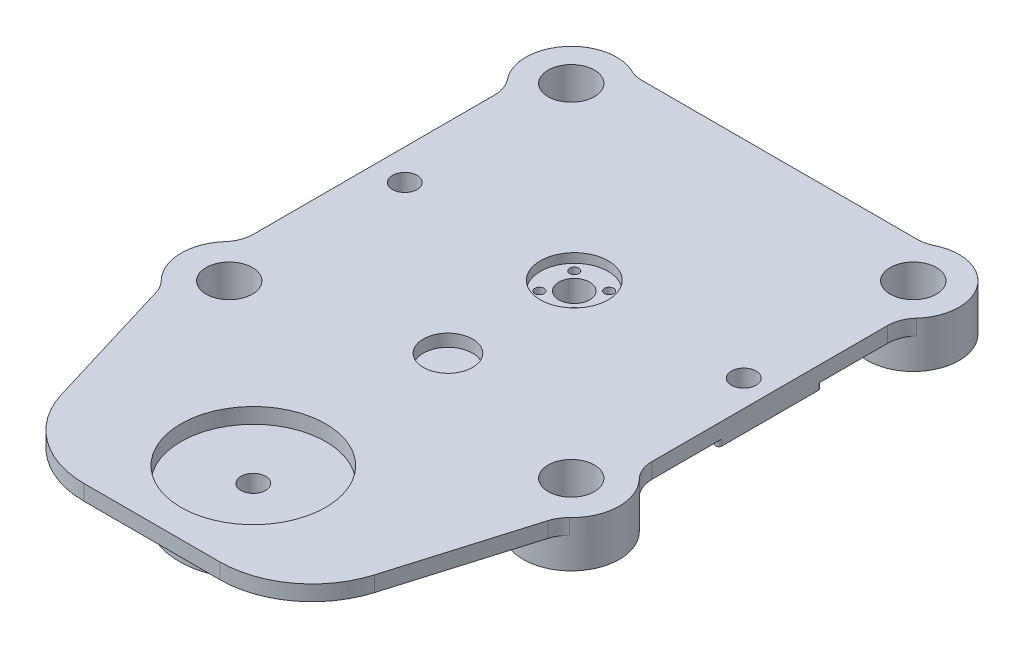
from build123d import *
from build123d.topology import SkipClean

# Parameters (mm, degrees)
SKETCH1_R           = 7.5
BOSS_EXTRUDE1_DEPTH = 15
SKETCH4_R           = 5
CUT_EXTRUDE2_DEPTH  = 20
SKETCH5_R           = 11
CUT_EXTRUDE3_DEPTH  = 3
SKETCH6_R           = 1.5
CUT_EXTRUDE4_DEPTH  = 133.338393859
SKETCH7_R           = 8
CUT_EXTRUDE5_DEPTH  = 4
FILLET3_R           = 30
FILLET4_R           = 10
SKETCH9_R           = 23.5
CUT_EXTRUDE6_DEPTH  = 5
SKETCH10_R          = 4
CUT_EXTRUDE7_DEPTH  = 133.172048819
SKETCH11_R          = 12
CUT_EXTRUDE8_DEPTH  = 8
FILLET5_R           = 10
SKETCH12_R          = 4
CUT_EXTRUDE9_DEPTH  = 133.035792455
SKETCH14_R          = 24
SKETCH14_R_2        = 15
CUT_EXTRUDE16_DEPTH = 10
FILLET6_R           = 10
FILLET7_START       = 8
FILLET7_DEPTH       = 2


with BuildPart() as part:
    # Sketch1 → Boss-Extrude1 (new body)
    with BuildSketch(Plane(origin=(0, 0, 0), x_dir=(1, 0, 0), z_dir=(0, 1, 0))):
        with BuildLine():
            Line((-47.707272336, 93.074011467), (46.85801727, 93.074011467))
            ThreePointArc((46.85801727, 93.074011467), (67.451414768, 89.11955675), (63.55694563, 68.514731035))
            Line((63.55694563, 68.514731035), (63.55694563, -17.060551097))
            ThreePointArc((63.55694563, -17.060551097), (70.78018401, -29.882416282), (64.134785378, -43.013070362))
            Line((64.134785378, -43.013070362), (43.994737315, -110.750576059))
            Line((43.994737315, -110.750576059), (-44.651292342, -110.750576059))
            Line((-44.651292342, -110.750576059), (-65.275039181, -42.659888117))
            ThreePointArc((-65.275039181, -42.659888117), (-71.439667546, -30.058632987), (-65, -17.595689691))
            Line((-65, -17.595689691), (-65, 69.228067604))
            ThreePointArc((-65, 69.228067604), (-67.7628182, 89.424810491), (-47.707272336, 93.074011467))
        make_face()
        with Locations(Location((-55.828277514, 80.770057168, 0), (0, 0, 270))):
            Circle(SKETCH1_R, mode=Mode.SUBTRACT)
        with Locations(Location((55.171722486, 80.770057168, 0), (0, 0, 270))):
            Circle(SKETCH1_R, mode=Mode.SUBTRACT)
        with Locations(Location((-55.828277514, -30.229942832, 0), (0, 0, 270))):
            Circle(SKETCH1_R, mode=Mode.SUBTRACT)
        with Locations(Location((55.171722486, -30.229942832, 0), (0, 0, 270))):
            Circle(SKETCH1_R, mode=Mode.SUBTRACT)
    extrude(amount=BOSS_EXTRUDE1_DEPTH)

    # Sketch4 → Cut-Extrude2 (cut)
    with BuildSketch(Plane(origin=(0, 15, 0), x_dir=(1, 0, 0), z_dir=(0, 1, 0))):
        with Locations(Location((0, 25.91137957, 0), (0, 0, 270))):
            Circle(SKETCH4_R)
    extrude(amount=-CUT_EXTRUDE2_DEPTH, mode=Mode.SUBTRACT)

    # Sketch5 → Cut-Extrude3 (cut)
    with BuildSketch(Plane(origin=(0, 15, 0), x_dir=(1, 0, 0), z_dir=(0, 1, 0))):
        with Locations(Location((0, 25.91137957, 0), (0, 0, 270))):
            Circle(SKETCH5_R)
    extrude(amount=-CUT_EXTRUDE3_DEPTH, mode=Mode.SUBTRACT)

    # Sketch6 → Cut-Extrude4 (cut, through all)
    with BuildSketch(Plane(origin=(0, 12, 0), x_dir=(1, 0, 0), z_dir=(0, 1, 0))):
        with Locations(Location((-5.656854249, 31.568233819, 0), (0, 0, 270))):
            Circle(SKETCH6_R)
        with Locations(Location((5.656854249, 31.568233819, 0), (0, 0, 270))):
            Circle(SKETCH6_R)
        with Locations(Location((5.656854249, 20.25452532, 0), (0, 0, 270))):
            Circle(SKETCH6_R)
        with Locations(Location((-5.656854249, 20.25452532, 0), (0, 0, 270))):
            Circle(SKETCH6_R)
    extrude(amount=-CUT_EXTRUDE4_DEPTH, mode=Mode.SUBTRACT)

    # Sketch7 → Cut-Extrude5 (cut)
    with BuildSketch(Plane(origin=(0, 15, 0), x_dir=(1, 0, 0), z_dir=(0, 1, 0))):
        with Locations(Location((0, -15.077036946, 0), (0, 0, 270))):
            Circle(SKETCH7_R)
    extrude(amount=-CUT_EXTRUDE5_DEPTH, mode=Mode.SUBTRACT)

    # Fillet3
    fillet3_edges = [part.edges().sort_by_distance(p)[0] for p in [
        (43.994737315, 7.5, 110.750576059),
        (-44.651292342, 7.5, 110.750576059),
    ]]
    fillet(fillet3_edges, radius=FILLET3_R)

    # Fillet4
    fillet4_edges = [part.edges().sort_by_distance(p)[0] for p in [
        (64.134785378, 7.5, 43.013070362),
        (-65.275039181, 7.5, 42.659888117),
    ]]
    fillet(fillet4_edges, radius=FILLET4_R)

    # Sketch9 → Cut-Extrude6 (cut)
    with BuildSketch(Plane(origin=(0, 15, 0), x_dir=(1, 0, 0), z_dir=(0, 1, 0))):
        with Locations(Location((0, -78.250576059, 0), (0, 0, 270))):
            Circle(SKETCH9_R)
    extrude(amount=-CUT_EXTRUDE6_DEPTH, mode=Mode.SUBTRACT)

    # Sketch10 → Cut-Extrude7 (cut, through all)
    with BuildSketch(Plane(origin=(0, 10, 0), x_dir=(1, 0, 0), z_dir=(0, 1, 0))):
        with Locations(Location((0, -78.250576059, 0), (0, 0, 270))):
            Circle(SKETCH10_R)
    extrude(amount=-CUT_EXTRUDE7_DEPTH, mode=Mode.SUBTRACT)

    # Sketch11 → Cut-Extrude8 (cut)
    with BuildSketch(Plane.XZ):
        with Locations((-55, -25.91137957)):
            Circle(SKETCH11_R)
        with Locations((55, -25.91137957)):
            Circle(SKETCH11_R)
    extrude(amount=-CUT_EXTRUDE8_DEPTH, mode=Mode.SUBTRACT)

    # Fillet5
    fillet5_edges = [part.edges().sort_by_distance(p)[0] for p in [
        (63.55694563, 4, -17.498372885),
        (63.55694563, 4, -34.324386255),
        (-65, 4, -32.544629151),
        (-65, 4, -19.278129989),
    ]]
    fillet(fillet5_edges, radius=FILLET5_R)

    # Sketch12 → Cut-Extrude9 (cut, through all)
    with BuildSketch(Plane.XZ.offset(-8)):
        with Locations(Location((-55, -25.91137957, 0), (0, 0, 270))):
            Circle(SKETCH12_R)
        with Locations(Location((55, -25.91137957, 0), (0, 0, 270))):
            Circle(SKETCH12_R)
    extrude(amount=-CUT_EXTRUDE9_DEPTH, mode=Mode.SUBTRACT)

    # Sketch14 → Cut-Extrude16 (cut)
    with SkipClean():  # the faces are left unmerged after this step: merging them gives an invalid solid
        with BuildSketch(Plane.XZ):
            with BuildLine():
                Line((63.55694563, -3.958757993), (63.55694563, 17.060551097))
                ThreePointArc((63.55694563, 17.060551097), (39.633853338, 31.752922858), (65.954448155, 41.520543922))
                ThreePointArc((65.954448155, 41.520543922), (64.328969033, 43.536593055), (63.275701742, 45.902446917))
                Line((63.275701742, 45.902446917), (50.37240498, 89.300413753))
                ThreePointArc((50.37240498, 89.300413753), (39.553990203, 104.79735475), (21.616531225, 110.750576059))
                Line((21.616531225, 110.750576059), (-22.391974152, 110.750576059))
                ThreePointArc((-22.391974152, 110.750576059), (-40.268031225, 104.843035119), (-51.103852363, 89.447014961))
                Line((-51.103852363, 89.447014961), (-64.46051315, 45.349100617))
                ThreePointArc((-64.46051315, 45.349100617), (-65.439681201, 43.13060481), (-66.9240694, 41.213032024))
                ThreePointArc((-66.9240694, 41.213032024), (-40.267501523, 31.497655875), (-65, 17.595689691))
                Line((-65, 17.595689691), (-65, -3.91137957))
                ThreePointArc((-65, -3.91137957), (-62.071067812, -10.982447382), (-55, -13.91137957))
                ThreePointArc((-55, -13.91137957), (-43, -25.91137957), (-55, -37.91137957))
                ThreePointArc((-55, -37.91137957), (-62.071067812, -40.840311758), (-65, -47.91137957))
                Line((-65, -47.91137957), (-65, -69.228067604))
                ThreePointArc((-65, -69.228067604), (-43.893736828, -72.115303846), (-47.707272336, -93.074011467))
                Line((-47.707272336, -93.074011467), (46.85801727, -93.074011467))
                ThreePointArc((46.85801727, -93.074011467), (42.892030205, -72.420557586), (63.55694563, -68.514731035))
                Line((63.55694563, -68.514731035), (63.55694563, -47.864001147))
                ThreePointArc((63.55694563, -47.864001147), (60.856237995, -41.028773939), (54.212879435, -37.885536794))
                ThreePointArc((54.212879435, -37.885536794), (43, -25.91137957), (54.212879435, -13.937222346))
                ThreePointArc((54.212879435, -13.937222346), (60.856237995, -10.793985201), (63.55694563, -3.958757993))
            make_face()
            with Locations(Location((0, 78.250576059, 0), (0, 0, 270))):
                Circle(SKETCH14_R, mode=Mode.SUBTRACT)
            with Locations(Location((0, -25.91137957, 0), (0, 0, 270))):
                Circle(SKETCH14_R_2, mode=Mode.SUBTRACT)
        extrude(amount=-CUT_EXTRUDE16_DEPTH, mode=Mode.SUBTRACT)

    # Fillet6
    fillet6_edges = [part.edges().sort_by_distance(p)[0] for p in [
        (-47.707272336, 12.5, -93.074011467),
        (46.85801727, 12.5, -93.074011467),
        (63.55694563, 12.5, -68.514731035),
        (63.55694563, 12.5, 17.060551097),
        (-65, 12.5, 17.595689691),
        (-65, 12.5, -69.228067604),
    ]]
    fillet(fillet6_edges, radius=FILLET6_R)

    # Fillet7: read off the stored shape, not the designer's step
    # Fillet7 outline → Fillet7 (cut)
    with SkipClean():  # the faces are left unmerged after this step: merging them gives an invalid solid
        with BuildSketch(Plane(origin=(0, 0, 0), x_dir=(1, 0, 0), z_dir=(0, 1, 0)).offset(FILLET7_START)):
            with BuildLine():
                ThreePointArc((-65, 3.91137957), (-64.534625893, 6.926493016), (-63.181818182, 9.660975316))
                ThreePointArc((-63.181818182, 9.660975316), (-64.301511345, 9.282472301), (-65, 10.23593489))
                Line((-65, 10.23593489), (-65, 3.91137957))
            make_face()
            with BuildLine():
                Line((-65, 47.91137957), (-65, 41.58682425))
                ThreePointArc((-65, 41.58682425), (-64.301511345, 42.540286839), (-63.181818182, 42.161783824))
                ThreePointArc((-63.181818182, 42.161783824), (-64.534625893, 44.896266124), (-65, 47.91137957))
            make_face()
            with BuildLine():
                ThreePointArc((63.55694563, 47.864001147), (63.091571523, 44.848887701), (61.738763812, 42.114405401))
                ThreePointArc((61.738763812, 42.114405401), (62.858456975, 42.492908415), (63.55694563, 41.539445826))
                Line((63.55694563, 41.539445826), (63.55694563, 47.864001147))
            make_face()
            with BuildLine():
                Line((63.55694563, 3.958757993), (63.55694563, 10.283313314))
                ThreePointArc((63.55694563, 10.283313314), (62.858456975, 9.329850724), (61.738763812, 9.708353739))
                ThreePointArc((61.738763812, 9.708353739), (63.091571523, 6.973871439), (63.55694563, 3.958757993))
            make_face()
        extrude(amount=FILLET7_DEPTH, mode=Mode.SUBTRACT)


solid = part.part
